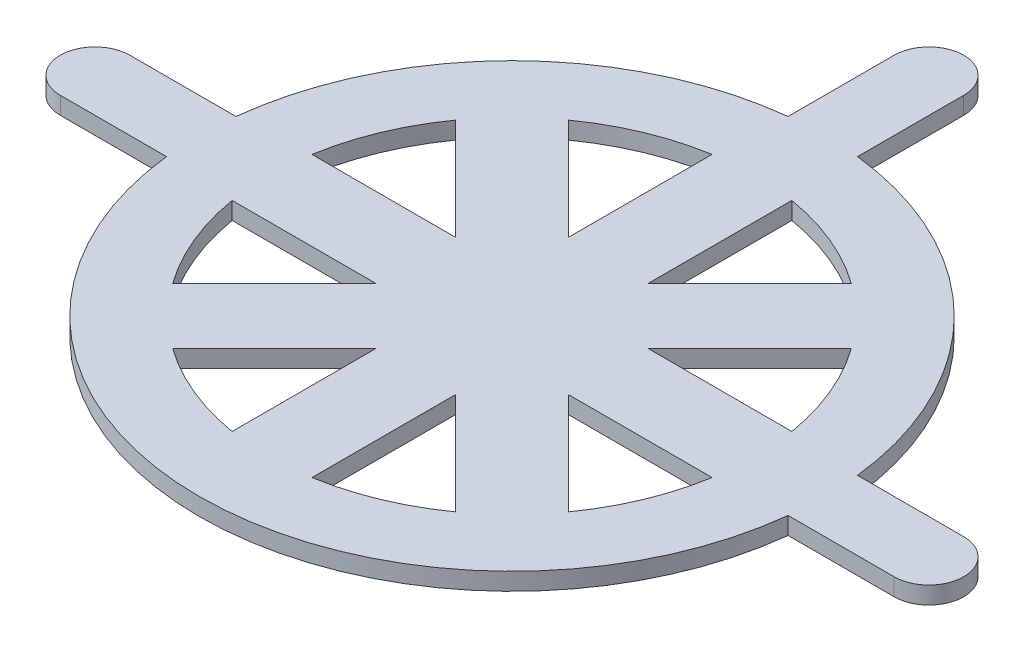
from build123d import *

# Parameters (mm, degrees)
BOSS_EXTRUDE1_DEPTH = 1.5875


with BuildPart() as part:
    # Sketch1 → Boss-Extrude1 (new body)
    with BuildSketch(Plane(origin=(0, 0, 0), x_dir=(1, 0, 0), z_dir=(0, 1, 0))):
        with BuildLine():
            ThreePointArc((3.175, 38.1), (0, 41.275), (-3.175, 38.1))
            Line((-3.175, 38.1), (-3.175, 28.398063314))
            ThreePointArc((-3.175, 28.398063314), (-20.205576272, 20.205576272), (-28.398063314, 3.175))
            Line((-28.398063314, 3.175), (-38.1, 3.175))
            ThreePointArc((-38.1, 3.175), (-41.275, 0), (-38.1, -3.175))
            Line((-38.1, -3.175), (-28.398063314, -3.175))
            ThreePointArc((-28.398063314, -3.175), (0, -28.575), (28.398063314, -3.175))
            Line((28.398063314, -3.175), (38.1, -3.175))
            ThreePointArc((38.1, -3.175), (41.275, 0), (38.1, 3.175))
            Line((38.1, 3.175), (28.398063314, 3.175))
            ThreePointArc((28.398063314, 3.175), (20.205576272, 20.205576272), (3.175, 28.398063314))
            Line((3.175, 28.398063314), (3.175, 38.1))
        make_face()
        with BuildLine():
            ThreePointArc((3.645059693, 21.92405448), (8.505139284, 20.53322261), (12.925201167, 18.080094021))
            Line((12.925201167, 18.080094021), (3.645059693, 8.799952547))
            Line((3.645059693, 8.799952547), (3.645059693, 21.92405448))
        make_face(mode=Mode.SUBTRACT)
        with BuildLine():
            ThreePointArc((-12.925201167, 18.080094021), (-8.505139284, 20.53322261), (-3.645059693, 21.92405448))
            Line((-3.645059693, 21.92405448), (-3.645059693, 8.799952547))
            Line((-3.645059693, 8.799952547), (-12.925201167, 18.080094021))
        make_face(mode=Mode.SUBTRACT)
        with BuildLine():
            ThreePointArc((-21.92405448, 3.645059693), (-20.53322261, 8.505139284), (-18.080094021, 12.925201167))
            Line((-18.080094021, 12.925201167), (-8.799952547, 3.645059693))
            Line((-8.799952547, 3.645059693), (-21.92405448, 3.645059693))
        make_face(mode=Mode.SUBTRACT)
        with BuildLine():
            ThreePointArc((-18.080094021, -12.925201167), (-20.53322261, -8.505139284), (-21.92405448, -3.645059693))
            Line((-21.92405448, -3.645059693), (-8.799952547, -3.645059693))
            Line((-8.799952547, -3.645059693), (-18.080094021, -12.925201167))
        make_face(mode=Mode.SUBTRACT)
        with BuildLine():
            ThreePointArc((-3.645059693, -21.92405448), (-8.505139284, -20.53322261), (-12.925201167, -18.080094021))
            Line((-12.925201167, -18.080094021), (-3.645059693, -8.799952547))
            Line((-3.645059693, -8.799952547), (-3.645059693, -21.92405448))
        make_face(mode=Mode.SUBTRACT)
        with BuildLine():
            ThreePointArc((12.925201167, -18.080094021), (8.505139284, -20.53322261), (3.645059693, -21.92405448))
            Line((3.645059693, -21.92405448), (3.645059693, -8.799952547))
            Line((3.645059693, -8.799952547), (12.925201167, -18.080094021))
        make_face(mode=Mode.SUBTRACT)
        with BuildLine():
            ThreePointArc((21.92405448, -3.645059693), (20.53322261, -8.505139284), (18.080094021, -12.925201167))
            Line((18.080094021, -12.925201167), (8.799952547, -3.645059693))
            Line((8.799952547, -3.645059693), (21.92405448, -3.645059693))
        make_face(mode=Mode.SUBTRACT)
        with BuildLine():
            ThreePointArc((18.080094021, 12.925201167), (20.53322261, 8.505139284), (21.92405448, 3.645059693))
            Line((21.92405448, 3.645059693), (8.799952547, 3.645059693))
            Line((8.799952547, 3.645059693), (18.080094021, 12.925201167))
        make_face(mode=Mode.SUBTRACT)
    extrude(amount=BOSS_EXTRUDE1_DEPTH)


solid = part.part
